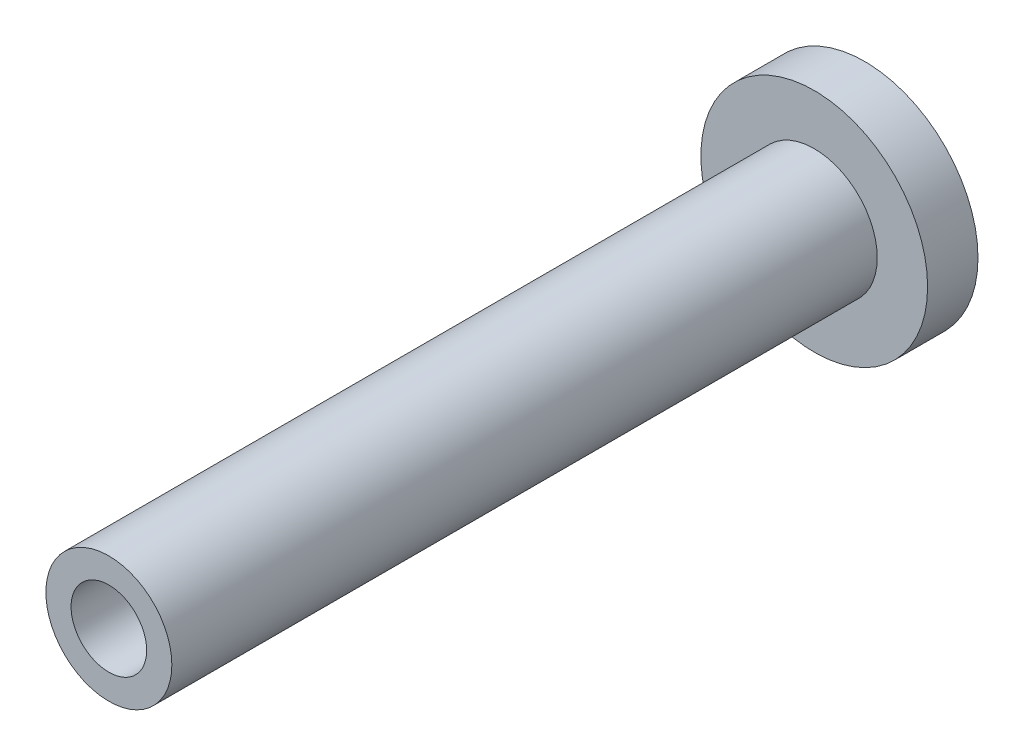
from build123d import *

# Parameters (mm, degrees)
SKETCH1_R           = 4.5
SKETCH1_R_2         = 2.5
BOSS_EXTRUDE1_DEPTH = 2
SKETCH5_R           = 2.5
BOSS_EXTRUDE3_DEPTH = 28
SKETCH6_R           = 1.5
CUT_EXTRUDE3_DEPTH  = 10
BOSS_EXTRUDE4_START = 1
SKETCH7_R           = 2.5
BOSS_EXTRUDE4_DEPTH = 1
FILLET1_R           = 2


with BuildPart() as part:
    # Sketch1 → Boss-Extrude1 (new body)
    with BuildSketch(Plane.XY):
        Circle(SKETCH1_R)
        Circle(SKETCH1_R_2, mode=Mode.SUBTRACT)
    extrude(amount=BOSS_EXTRUDE1_DEPTH)



with BuildPart() as body_2:
    # Sketch5 → Boss-Extrude3 (new body)
    with BuildSketch(Plane.XY.offset(2)):
        Circle(SKETCH5_R)
    extrude(amount=BOSS_EXTRUDE3_DEPTH)

    # Sketch6 → Cut-Extrude3 (cut)
    with BuildSketch(Plane.XY.offset(30)):
        Circle(SKETCH6_R)
    extrude(amount=-CUT_EXTRUDE3_DEPTH, mode=Mode.SUBTRACT)


with BuildPart() as part_1:
    add(part.part)

    add(body_2.part)  # Boss-Extrude4 merges body 2
    # Sketch7 → Boss-Extrude4 (add)
    with BuildSketch(Plane(origin=(0, 0, 2), x_dir=(-1, 0, 0), z_dir=(0, 0, -1)).offset(BOSS_EXTRUDE4_START)):
        Circle(SKETCH7_R)
    extrude(amount=-BOSS_EXTRUDE4_DEPTH)

    # Fillet1
    # the kernel refuses this fillet: 2 mm, written as the material it takes off along each edge
    with BuildSketch(Plane(origin=(0, 0, 0), x_dir=(1, 0, 0), z_dir=(0, -1, 0))) as fillet1_piece_1:
        with BuildLine():
            CenterArc((4.232050808, 2), FILLET1_R, 210, 60)
            Line((2.5, 1), (2.465358984, 0.98))
            ThreePointArc((2.465358984, 0.98), (2.46, 0.5), (2.46, 0))
            Line((2.46, 0), (2.5, -0.04))
            Line((2.5, -0.04), (4.232050808, -0.04))
            Line((4.232050808, -0.04), (4.232050808, 0))
        make_face()
    revolve(axis=Axis((0, 0, 0), (0, 0, 1)), mode=Mode.SUBTRACT)


solid = part_1.part
